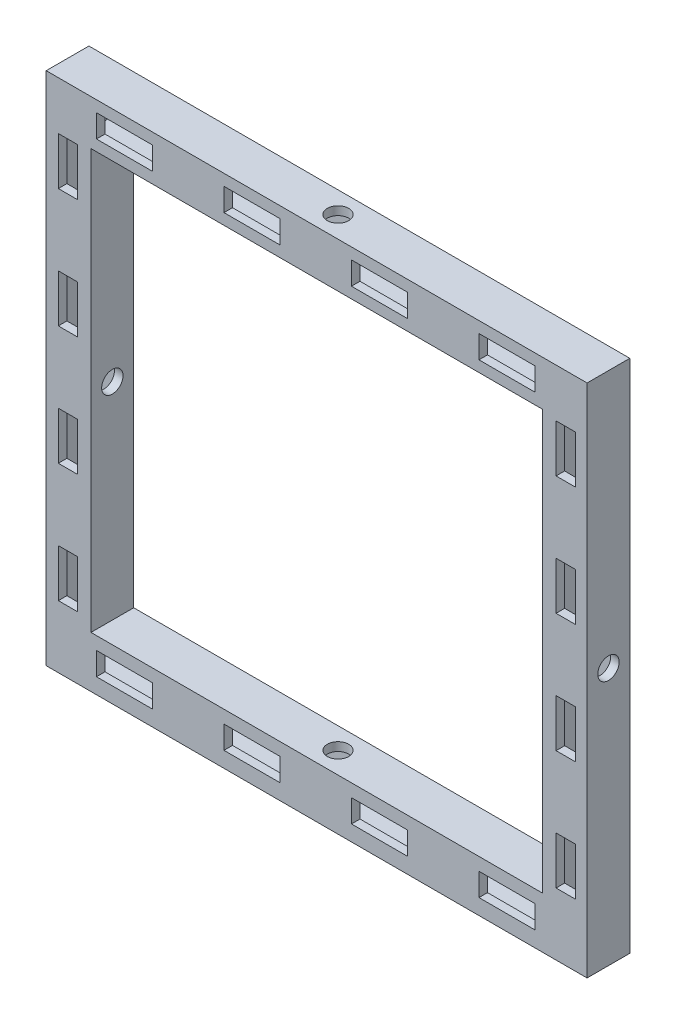
from build123d import *

# Parameters (mm, degrees)
SKETCH1_W            = 643.125455594
SKETCH1_H            = 612.725254334
BOSS_EXTRUDE1_DEPTH  = 50.8
SKETCH3_W            = 536.564550572
SKETCH3_H            = 498.238511246
CUT_EXTRUDE2_DEPTH   = 50.8
SHELL5_START         = -6.602727797
SHELL5_OUTLINE_W     = 40.586297515
SHELL5_OUTLINE_H     = 30.48
SHELL5_OUTLINE_W_2   = 33.260445573
SHELL5_DEPTH         = 622.805455594
SHELL5_START_2       = 583.214532361
SHELL5_2_OUTLINE_W   = 518.558511246
SHELL5_2_OUTLINE_H   = 30.48
SHELL5_2_DEPTH       = 32.988195436
SHELL5_3_OUTLINE_W   = 518.558511246
SHELL5_3_OUTLINE_H   = 30.48
SHELL5_3_DEPTH       = 32.932709586
SKETCH7_W            = 66.675404896
SKETCH7_H            = 27.093969604
CUT_EXTRUDE3_DEPTH   = 50.8
LPATTERN1_COUNT      = 4
LPATTERN1_PITCH      = 151.6
LPATTERN1_COUNT_DIR2 = 2
LPATTERN1_PITCH_DIR2 = 553.72
SKETCH8_W            = 22.902108828
SKETCH8_H            = 56.707978581
CUT_EXTRUDE4_DEPTH   = 50.8
LPATTERN2_COUNT      = 4
LPATTERN2_PITCH      = 141.44
LPATTERN2_COUNT_DIR2 = 2
LPATTERN2_PITCH_DIR2 = 591.82
SKETCH11_R           = 12.7
CUT_EXTRUDE5_DEPTH   = 635
SKETCH12_R           = 12.7
CUT_EXTRUDE7_DEPTH   = 660.4


# Read off the part's stored shape, not the designer's step: Shell5
with BuildPart() as part:
    # Sketch1 → Boss-Extrude1 (new body)
    with BuildSketch(Plane.XY):
        with Locations((304.8, 304.8)):
            Rectangle(SKETCH1_W, SKETCH1_H)
    extrude(amount=BOSS_EXTRUDE1_DEPTH)

    # Sketch3 → Cut-Extrude2 (cut)
    with BuildSketch(Plane.XY.offset(50.8)):
        with Locations((304.772257075, 308.462925971)):
            Rectangle(SKETCH3_W, SKETCH3_H)
    extrude(amount=-CUT_EXTRUDE2_DEPTH, mode=Mode.SUBTRACT)

    # Shell5 outline → Shell5 (cut)
    with BuildSketch(Plane.YZ.offset(SHELL5_START)):
        with Locations((28.890521591, 25.4)):
            Rectangle(SHELL5_OUTLINE_W, SHELL5_OUTLINE_H)
        with Locations((584.372404381, 25.4)):
            Rectangle(SHELL5_OUTLINE_W_2, SHELL5_OUTLINE_H)
    extrude(amount=SHELL5_DEPTH, mode=Mode.SUBTRACT)

    # Shell5 2 outline → Shell5 2 (cut)
    with BuildSketch(Plane.YZ.offset(SHELL5_START_2)):
        with Locations((308.462925971, 25.4)):
            Rectangle(SHELL5_2_OUTLINE_W, SHELL5_2_OUTLINE_H)
    extrude(amount=SHELL5_2_DEPTH, mode=Mode.SUBTRACT)

    # Shell5 3 outline → Shell5 3 (cut)
    with BuildSketch(Plane.YZ.offset(SHELL5_START)):
        with Locations((308.462925971, 25.4)):
            Rectangle(SHELL5_3_OUTLINE_W, SHELL5_3_OUTLINE_H)
    extrude(amount=SHELL5_3_DEPTH, mode=Mode.SUBTRACT)

    # Sketch7 → Cut-Extrude3 (cut)
    with BuildSketch(Plane.XY.offset(50.8)):
        with Locations((76.34692027, 584.240607078)):
            Rectangle(SKETCH7_W, SKETCH7_H)
    cut_extrude3 = extrude(amount=-CUT_EXTRUDE3_DEPTH, mode=Mode.SUBTRACT)

    # LPattern1: Cut-Extrude3 4 × 2
    with Locations(*[(i * LPATTERN1_PITCH, -j * LPATTERN1_PITCH_DIR2, 0) for i in range(LPATTERN1_COUNT) for j in range(LPATTERN1_COUNT_DIR2) if (i, j) != (0, 0)]):
        add(cut_extrude3, mode=Mode.SUBTRACT)

    # Sketch8 → Cut-Extrude4 (cut)
    with BuildSketch(Plane.XY.offset(50.8)):
        with Locations((9.129138523, 525.334860242)):
            Rectangle(SKETCH8_W, SKETCH8_H)
    cut_extrude4 = extrude(amount=-CUT_EXTRUDE4_DEPTH, mode=Mode.SUBTRACT)

    # LPattern2: Cut-Extrude4 4 × 2
    with Locations(*[(j * LPATTERN2_PITCH_DIR2, -i * LPATTERN2_PITCH, 0) for i in range(LPATTERN2_COUNT) for j in range(LPATTERN2_COUNT_DIR2) if (i, j) != (0, 0)]):
        add(cut_extrude4, mode=Mode.SUBTRACT)

    # Sketch11 → Cut-Extrude5 (cut)
    with BuildSketch(Plane(origin=(0, 611.162627167, 0), x_dir=(1, 0, 0), z_dir=(0, 1, 0))):
        with Locations(Location((304.8, -25.4, 0), (0, 0, 270))):
            Circle(SKETCH11_R)
    extrude(amount=-CUT_EXTRUDE5_DEPTH, mode=Mode.SUBTRACT)

    # Sketch12 → Cut-Extrude7 (cut)
    with BuildSketch(Plane(origin=(626.362727797, 0, 0), x_dir=(0, 0, -1), z_dir=(1, 0, 0))):
        with Locations(Location((-25.4, 304.8, 0), (0, 0, 180))):
            Circle(SKETCH12_R)
    extrude(amount=-CUT_EXTRUDE7_DEPTH, mode=Mode.SUBTRACT)


solid = part.part
